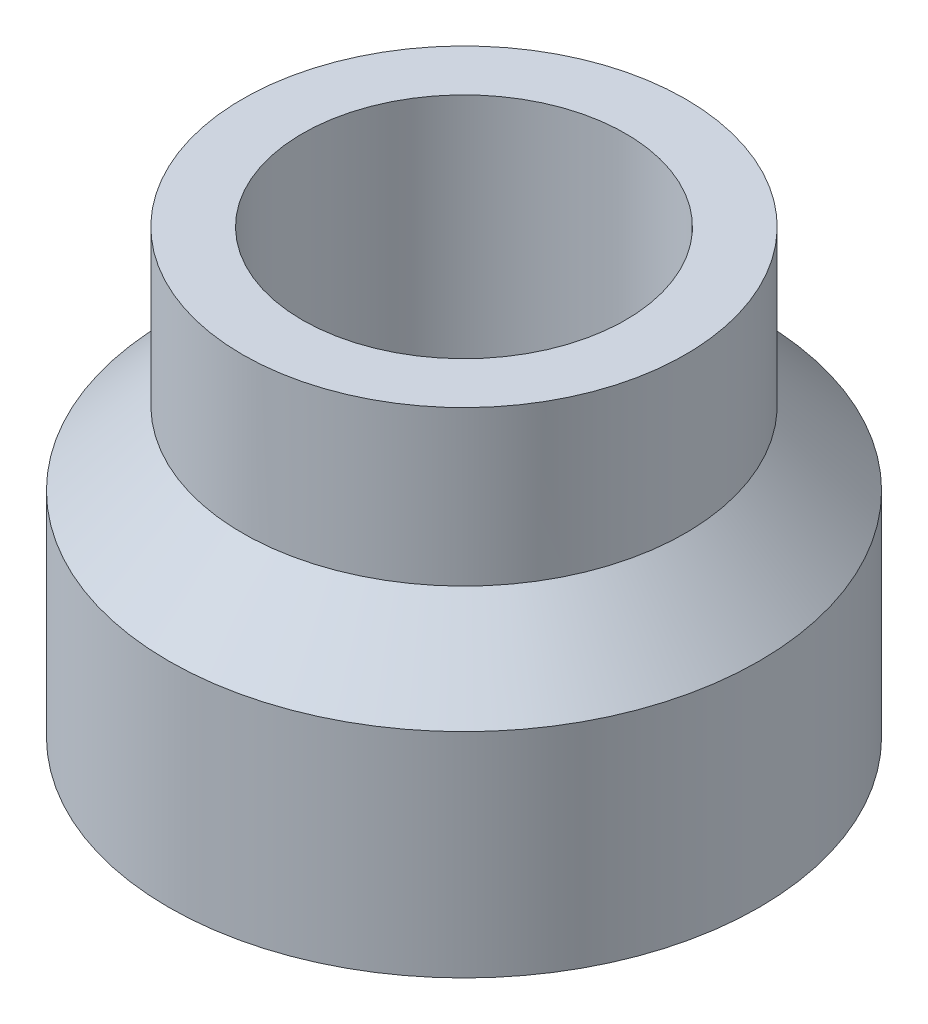
from build123d import *

# Parameters (mm, degrees)
SKETCH1_R           = 6.35
SKETCH1_R_2         = 4.7625
BOSS_EXTRUDE1_DEPTH = 3.175
SKETCH1_3_R         = 4.7625
SKETCH1_3_R_2       = 3.475
BOSS_EXTRUDE2_DEPTH = 9.5
CHAMFER1_SIZE       = 3


with BuildPart() as part:
    # Sketch1 → Boss-Extrude1 (new body)
    with BuildSketch(Plane(origin=(0, 0, 0), x_dir=(1, 0, 0), z_dir=(0, 1, 0))):
        with Locations(Location((0, 0, 0), (0, 0, 270))):
            Circle(SKETCH1_R)
        with Locations(Location((0, 0, 0), (0, 0, 270))):
            Circle(SKETCH1_R_2, mode=Mode.SUBTRACT)
    extrude(amount=BOSS_EXTRUDE1_DEPTH)

    # Sketch1<3> → Boss-Extrude2 (add)
    with BuildSketch(Plane(origin=(0, 0, 0), x_dir=(1, 0, 0), z_dir=(0, 1, 0))):
        with Locations(Location((0, 0, 0), (0, 0, 270))):
            Circle(SKETCH1_3_R)
        with Locations(Location((0, 0, 0), (0, 0, 270))):
            Circle(SKETCH1_3_R_2, mode=Mode.SUBTRACT)
    extrude(amount=BOSS_EXTRUDE2_DEPTH)

    # Chamfer1
    # the kernel refuses this chamfer: 3 mm, written as the material it adds along each edge
    with BuildSketch(Plane(origin=(0, 3.175, 0), x_dir=(0, 0, 1), z_dir=(-1, 0, 0))) as chamfer1_piece_1_section:
        Polygon((4.7625 + CHAMFER1_SIZE, 0), (4.7625, CHAMFER1_SIZE), (4.7625, 0), align=None)
    chamfer1_piece_1 = revolve(axis=Axis((0, 3.175, 0), (0, 1, 0)), mode=Mode.PRIVATE)
    chamfer1_piece_1 = chamfer1_piece_1 & Plane(origin=(0, 5.38786909, 0), x_dir=(0, 0, 1), z_dir=(0, -1, 0)) * Cylinder(6.35, 32, mode=Mode.PRIVATE)
    add(chamfer1_piece_1)


solid = part.part
